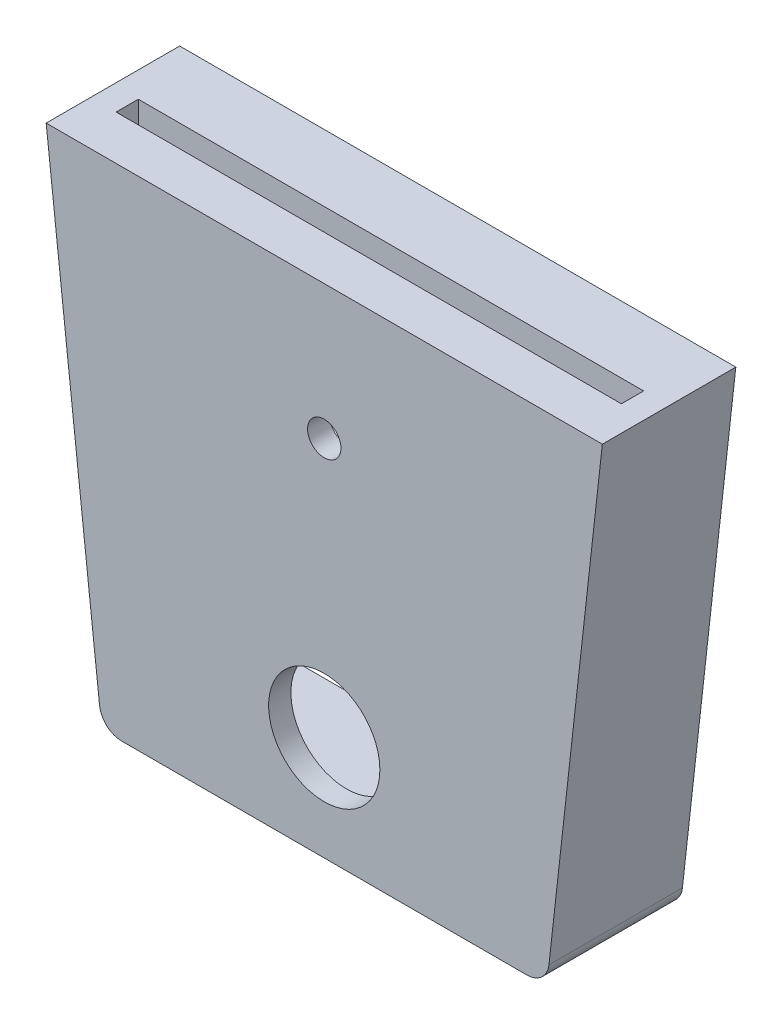
from build123d import *

# Parameters (mm, degrees)
SKETCH1_R           = 3.81
SKETCH1_R_2         = 12.7
BOSS_EXTRUDE1_DEPTH = 5.08
BOSS_EXTRUDE2_DEPTH = 25.4
SKETCH3_W           = 115.38555028
SKETCH3_H           = 5.08
CUT_EXTRUDE2_DEPTH  = 6.35
BOSS_EXTRUDE3_DEPTH = 2.54
SKETCH5_R           = 1.905
CUT_EXTRUDE3_DEPTH  = 2.54


with BuildPart() as part:
    # Sketch1 → Boss-Extrude1 (new body)
    with BuildSketch(Plane.XY):
        with BuildLine():
            Line((63.5, 56.7961272), (-63.5, 56.7961272))
            Line((-63.5, 56.7961272), (-51.304854459, -52.280570501))
            ThreePointArc((-51.304854459, -52.280570501), (-49.642976536, -55.502534499), (-46.25630987, -56.796126057))
            Line((-46.25630987, -56.796126057), (46.25630987, -56.796126057))
            ThreePointArc((46.25630987, -56.796126057), (49.642976536, -55.502534499), (51.304854459, -52.280570501))
            Line((51.304854459, -52.280570501), (63.5, 56.7961272))
        make_face()
        with Locations((0, 26.169334365)):
            Circle(SKETCH1_R, mode=Mode.SUBTRACT)
        with Locations((0, -32.979057905)):
            Circle(SKETCH1_R_2, mode=Mode.SUBTRACT)
    extrude(amount=-BOSS_EXTRUDE1_DEPTH)

    # Sketch2 → Boss-Extrude2 (add)
    with BuildSketch(Plane.XY.offset(-5.08)):
        with BuildLine():
            Line((63.5, 56.7961272), (-63.5, 56.7961272))
            Line((-63.5, 56.7961272), (-51.304854459, -52.280570501))
            ThreePointArc((-51.304854459, -52.280570501), (-49.642976536, -55.502534499), (-46.25630987, -56.796126057))
            Line((-46.25630987, -56.796126057), (46.25630987, -56.796126057))
            ThreePointArc((46.25630987, -56.796126057), (49.642976536, -55.502534499), (51.304854459, -52.280570501))
            Line((51.304854459, -52.280570501), (63.5, 56.7961272))
        make_face()
        with BuildLine():
            Line((41.712619739, -51.716126057), (-41.712619739, -51.716126057))
            ThreePointArc((-41.712619739, -51.716126057), (-45.099286406, -50.422534499), (-46.761164329, -47.200570501))
            Line((-46.761164329, -47.200570501), (-57.820387337, 51.7161272))
            Line((-57.820387337, 51.7161272), (57.820387337, 51.7161272))
            Line((57.820387337, 51.7161272), (46.761164329, -47.200570501))
            ThreePointArc((46.761164329, -47.200570501), (45.099286406, -50.422534499), (41.712619739, -51.716126057))
        make_face(mode=Mode.SUBTRACT)
    extrude(amount=-BOSS_EXTRUDE2_DEPTH)

    # Sketch3 → Cut-Extrude2 (cut)
    with BuildSketch(Plane(origin=(0, 56.7961272, 0), x_dir=(1, 0, 0), z_dir=(0, 1, 0))):
        with Locations((2.54e-06, 12.7)):
            Rectangle(SKETCH3_W, SKETCH3_H)
    extrude(amount=-CUT_EXTRUDE2_DEPTH, mode=Mode.SUBTRACT)

    # Sketch4 → Boss-Extrude3 (add)
    with BuildSketch(Plane(origin=(0, 0, -30.48), x_dir=(-1, 0, 0), z_dir=(0, 0, -1))):
        Polygon((-52.99583525, 8.564021488), (-33.94583525, 8.564021488), (-33.94583525, -4.135978512), (-51.575932084, -4.135978512), align=None)
        Polygon((33.94583525, -4.135978512), (51.575932084, -4.135978512), (52.99583525, 8.564021488), (33.94583525, 8.564021488), align=None)
    extrude(amount=-BOSS_EXTRUDE3_DEPTH)

    # Sketch5 → Cut-Extrude3 (cut)
    with BuildSketch(Plane(origin=(0, 0, -30.48), x_dir=(-1, 0, 0), z_dir=(0, 0, -1))):
        with Locations((-43.115859459, 2.214021488)):
            Circle(SKETCH5_R)
        with Locations((43.115859459, 2.214021488)):
            Circle(SKETCH5_R)
    extrude(amount=-CUT_EXTRUDE3_DEPTH, mode=Mode.SUBTRACT)


solid = part.part
